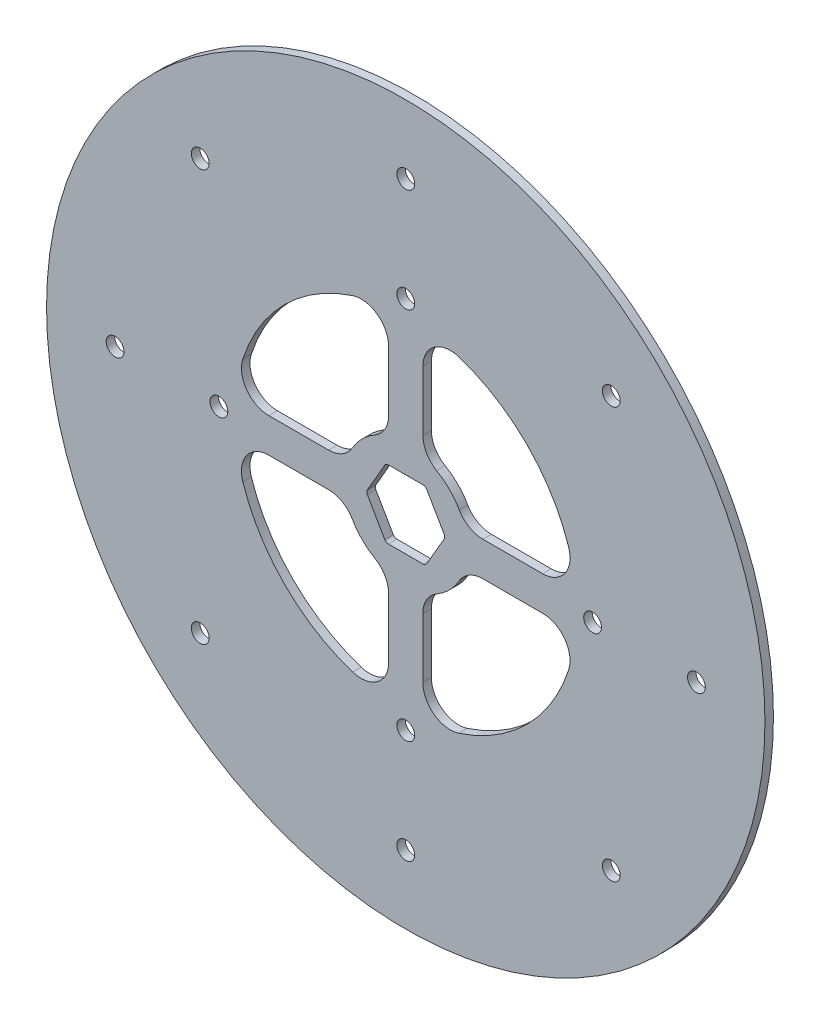
from build123d import *

# Parameters (mm, degrees)
SKETCH1_R           = 66.548
SKETCH1_R_2         = 1.651
BOSS_EXTRUDE1_DEPTH = 1.5748
FILLET6_R           = 0.762


with BuildPart() as part:
    # Sketch1 → Boss-Extrude1 (new body)
    with BuildSketch(Plane.XY):
        Circle(SKETCH1_R)
        with Locations((0, 53.848)):
            Circle(SKETCH1_R_2, mode=Mode.SUBTRACT)
        with Locations((0, 34.619591715)):
            Circle(SKETCH1_R_2, mode=Mode.SUBTRACT)
        with Locations((34.619591715, 0)):
            Circle(SKETCH1_R_2, mode=Mode.SUBTRACT)
        with Locations((0, -34.619591715)):
            Circle(SKETCH1_R_2, mode=Mode.SUBTRACT)
        with Locations((-34.619591715, 0)):
            Circle(SKETCH1_R_2, mode=Mode.SUBTRACT)
        with Locations((38.076285953, 38.076285953)):
            Circle(SKETCH1_R_2, mode=Mode.SUBTRACT)
        with Locations((53.848, 0)):
            Circle(SKETCH1_R_2, mode=Mode.SUBTRACT)
        with Locations((38.076285953, -38.076285953)):
            Circle(SKETCH1_R_2, mode=Mode.SUBTRACT)
        with Locations((0, -53.848)):
            Circle(SKETCH1_R_2, mode=Mode.SUBTRACT)
        with Locations((-38.076285953, -38.076285953)):
            Circle(SKETCH1_R_2, mode=Mode.SUBTRACT)
        with Locations((-53.848, 0)):
            Circle(SKETCH1_R_2, mode=Mode.SUBTRACT)
        with Locations((-38.076285953, 38.076285953)):
            Circle(SKETCH1_R_2, mode=Mode.SUBTRACT)
        with BuildLine():
            Line((25.360281446, 3.175), (14.298079416, 3.175))
            ThreePointArc((14.298079416, 3.175), (11.758079416, 3.855590949), (9.898670365, 5.715))
            ThreePointArc((9.898670365, 5.715), (8.082230509, 8.082230509), (5.715, 9.898670365))
            ThreePointArc((5.715, 9.898670365), (3.855590949, 11.758079416), (3.175, 14.298079416))
            Line((3.175, 14.298079416), (3.175, 25.360281446))
            ThreePointArc((3.175, 25.360281446), (5.270146171, 29.470883302), (9.827380952, 30.190811245))
            ThreePointArc((9.827380952, 30.190811245), (22.450640303, 22.450640303), (30.190811245, 9.827380952))
            ThreePointArc((30.190811245, 9.827380952), (29.470883302, 5.270146171), (25.360281446, 3.175))
        make_face(mode=Mode.SUBTRACT)
        with BuildLine():
            Line((-3.175, 25.360281446), (-3.175, 14.298079416))
            ThreePointArc((-3.175, 14.298079416), (-3.855590949, 11.758079416), (-5.715, 9.898670365))
            ThreePointArc((-5.715, 9.898670365), (-8.082230509, 8.082230509), (-9.898670365, 5.715))
            ThreePointArc((-9.898670365, 5.715), (-11.758079416, 3.855590949), (-14.298079416, 3.175))
            Line((-14.298079416, 3.175), (-25.360281446, 3.175))
            ThreePointArc((-25.360281446, 3.175), (-29.470883302, 5.270146171), (-30.190811245, 9.827380952))
            ThreePointArc((-30.190811245, 9.827380952), (-22.450640303, 22.450640303), (-9.827380952, 30.190811245))
            ThreePointArc((-9.827380952, 30.190811245), (-5.270146171, 29.470883302), (-3.175, 25.360281446))
        make_face(mode=Mode.SUBTRACT)
        with BuildLine():
            Line((3.175, -25.360281446), (3.175, -14.298079416))
            ThreePointArc((3.175, -14.298079416), (3.855590949, -11.758079416), (5.715, -9.898670365))
            ThreePointArc((5.715, -9.898670365), (8.082230509, -8.082230509), (9.898670365, -5.715))
            ThreePointArc((9.898670365, -5.715), (11.758079416, -3.855590949), (14.298079416, -3.175))
            Line((14.298079416, -3.175), (25.360281446, -3.175))
            ThreePointArc((25.360281446, -3.175), (29.470883302, -5.270146171), (30.190811245, -9.827380952))
            ThreePointArc((30.190811245, -9.827380952), (22.450640303, -22.450640303), (9.827380952, -30.190811245))
            ThreePointArc((9.827380952, -30.190811245), (5.270146171, -29.470883302), (3.175, -25.360281446))
        make_face(mode=Mode.SUBTRACT)
        Polygon((7.332348419, 0), (3.666174209, 6.35), (-3.666174209, 6.35), (-7.332348419, 0), (-3.666174209, -6.35), (3.666174209, -6.35), align=None, mode=Mode.SUBTRACT)
        with BuildLine():
            Line((-25.360281446, -3.175), (-14.298079416, -3.175))
            ThreePointArc((-14.298079416, -3.175), (-11.758079416, -3.855590949), (-9.898670365, -5.715))
            ThreePointArc((-9.898670365, -5.715), (-8.082230509, -8.082230509), (-5.715, -9.898670365))
            ThreePointArc((-5.715, -9.898670365), (-3.855590949, -11.758079416), (-3.175, -14.298079416))
            Line((-3.175, -14.298079416), (-3.175, -25.360281446))
            ThreePointArc((-3.175, -25.360281446), (-5.270146171, -29.470883302), (-9.827380952, -30.190811245))
            ThreePointArc((-9.827380952, -30.190811245), (-22.450640303, -22.450640303), (-30.190811245, -9.827380952))
            ThreePointArc((-30.190811245, -9.827380952), (-29.470883302, -5.270146171), (-25.360281446, -3.175))
        make_face(mode=Mode.SUBTRACT)
    extrude(amount=BOSS_EXTRUDE1_DEPTH)

    # Fillet6
    fillet6_edges = [part.edges().sort_by_distance(p)[0] for p in [
        (3.666174209, 6.35, 0.7874),
        (7.332348419, 0, 0.7874),
        (3.666174209, -6.35, 0.7874),
        (-3.666174209, -6.35, 0.7874),
        (-7.332348419, 0, 0.7874),
        (-3.666174209, 6.35, 0.7874),
    ]]
    fillet(fillet6_edges, radius=FILLET6_R)


solid = part.part
